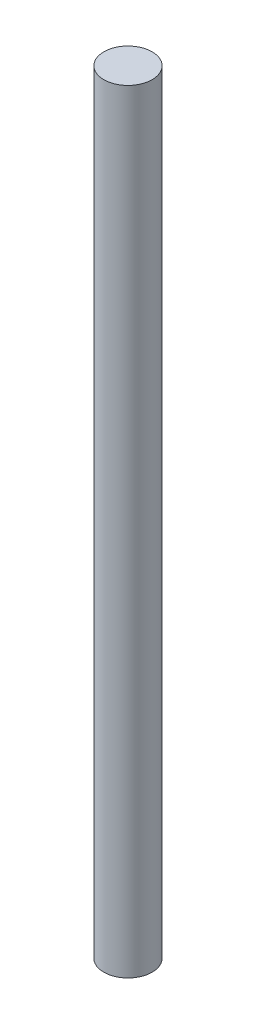
from build123d import *

# Parameters (mm, degrees)
SKETCH2_R           = 2.5
BOSS_EXTRUDE1_DEPTH = 80


with BuildPart() as part:
    # Sketch2 → Boss-Extrude1 (new body)
    with BuildSketch(Plane(origin=(0, 0, 0), x_dir=(1, 0, 0), z_dir=(0, 1, 0))):
        Circle(SKETCH2_R)
    extrude(amount=BOSS_EXTRUDE1_DEPTH)


solid = part.part
